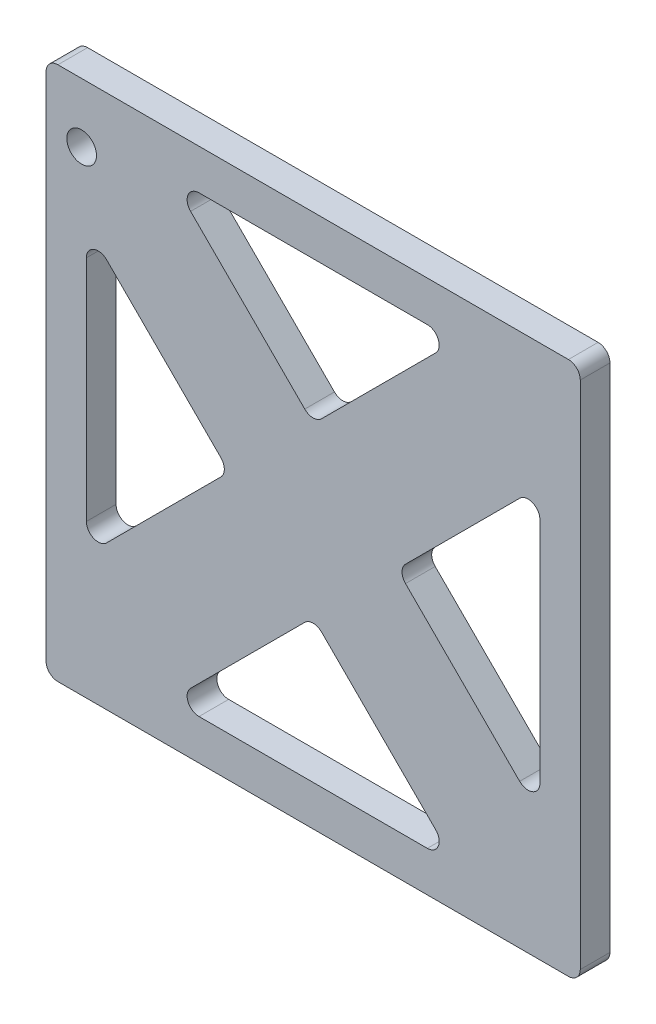
from build123d import *

# Parameters (mm, degrees)
SKETCH1_R           = 3.175
BOSS_EXTRUDE2_DEPTH = 3.175


with BuildPart() as part:
    # Sketch1 → Boss-Extrude2 (new, symmetric)
    with BuildSketch(Plane.XY):
        with BuildLine():
            Line((-54.61, -57.15), (54.61, -57.15))
            ThreePointArc((54.61, -57.15), (56.406051224, -56.406051224), (57.15, -54.61))
            Line((57.15, -54.61), (57.15, 54.61))
            ThreePointArc((57.15, 54.61), (56.406051224, 56.406051224), (54.61, 57.15))
            Line((54.61, 57.15), (-54.61, 57.15))
            ThreePointArc((-54.61, 57.15), (-56.406051224, 56.406051224), (-57.15, 54.61))
            Line((-57.15, 54.61), (-57.15, -54.61))
            ThreePointArc((-57.15, -54.61), (-56.406051224, -56.406051224), (-54.61, -57.15))
        make_face()
        with Locations((-49.53, 44.45)):
            Circle(SKETCH1_R, mode=Mode.SUBTRACT)
        with BuildLine():
            Line((-24.425187853, -48.517802544), (24.425187853, -48.517802544))
            ThreePointArc((24.425187853, -48.517802544), (26.771841866, -46.949818462), (26.221239077, -44.181751319))
            Line((26.221239077, -44.181751319), (1.796051224, -19.756563466))
            ThreePointArc((1.796051224, -19.756563466), (0, -19.012614691), (-1.796051224, -19.756563466))
            Line((-1.796051224, -19.756563466), (-26.221239077, -44.181751319))
            ThreePointArc((-26.221239077, -44.181751319), (-26.771841866, -46.949818462), (-24.425187853, -48.517802544))
        make_face(mode=Mode.SUBTRACT)
        with BuildLine():
            Line((-48.517802544, -24.425187853), (-48.517802544, 24.425187853))
            ThreePointArc((-48.517802544, 24.425187853), (-46.949818462, 26.771841866), (-44.181751319, 26.221239077))
            Line((-44.181751319, 26.221239077), (-19.756563466, 1.796051224))
            ThreePointArc((-19.756563466, 1.796051224), (-19.012614691, 0), (-19.756563466, -1.796051224))
            Line((-19.756563466, -1.796051224), (-44.181751319, -26.221239077))
            ThreePointArc((-44.181751319, -26.221239077), (-46.949818462, -26.771841866), (-48.517802544, -24.425187853))
        make_face(mode=Mode.SUBTRACT)
        with BuildLine():
            Line((48.517802544, -24.425187853), (48.517802544, 24.425187853))
            ThreePointArc((48.517802544, 24.425187853), (46.949818462, 26.771841866), (44.181751319, 26.221239077))
            Line((44.181751319, 26.221239077), (19.756563466, 1.796051224))
            ThreePointArc((19.756563466, 1.796051224), (19.012614691, 0), (19.756563466, -1.796051224))
            Line((19.756563466, -1.796051224), (44.181751319, -26.221239077))
            ThreePointArc((44.181751319, -26.221239077), (46.949818462, -26.771841866), (48.517802544, -24.425187853))
        make_face(mode=Mode.SUBTRACT)
        with BuildLine():
            Line((26.221239077, 44.181751319), (1.796051224, 19.756563466))
            ThreePointArc((1.796051224, 19.756563466), (0, 19.012614691), (-1.796051224, 19.756563466))
            Line((-1.796051224, 19.756563466), (-26.221239077, 44.181751319))
            ThreePointArc((-26.221239077, 44.181751319), (-26.771841866, 46.949818462), (-24.425187853, 48.517802544))
            Line((-24.425187853, 48.517802544), (24.425187853, 48.517802544))
            ThreePointArc((24.425187853, 48.517802544), (26.771841866, 46.949818462), (26.221239077, 44.181751319))
        make_face(mode=Mode.SUBTRACT)
    extrude(amount=BOSS_EXTRUDE2_DEPTH, both=True)


solid = part.part
